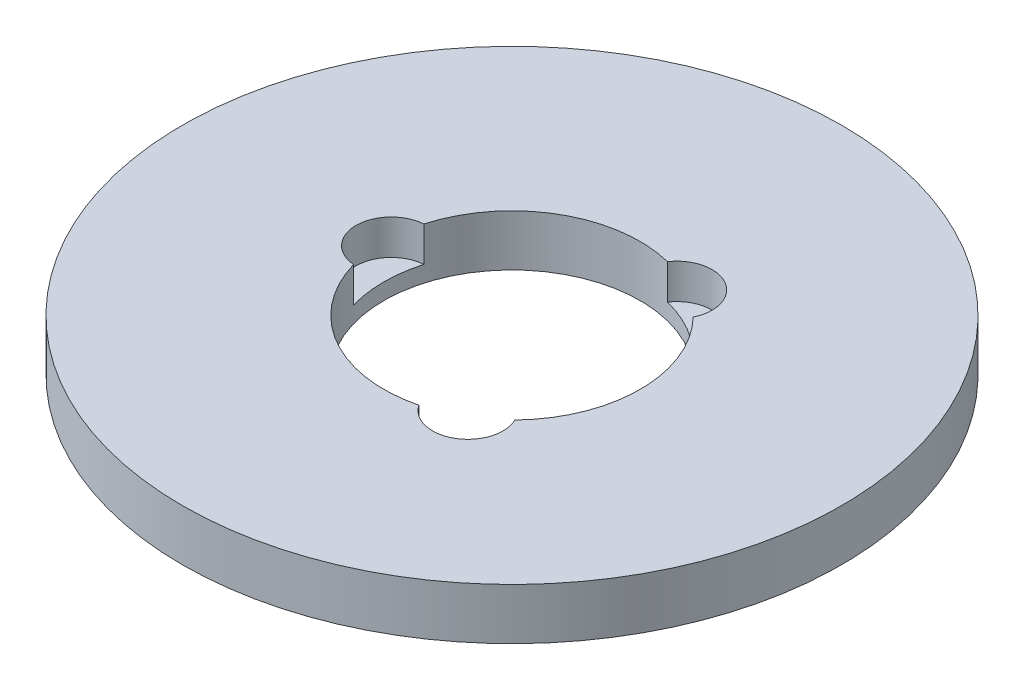
from build123d import *

# Parameters (mm, degrees)
SKETCH1_R           = 90
BOSS_EXTRUDE1_DEPTH = 14
SKETCH2_R           = 35
CUT_EXTRUDE1_DEPTH  = 129.04686642
SKETCH3_R           = 9.621439394
CUT_EXTRUDE2_DEPTH  = 9.567018908
CIRPATTERN1_COUNT   = 3


with BuildPart() as part:
    # Sketch1 → Boss-Extrude1 (new body)
    with BuildSketch(Plane(origin=(0, 0, 0), x_dir=(1, 0, 0), z_dir=(0, 1, 0))):
        Circle(SKETCH1_R)
    extrude(amount=BOSS_EXTRUDE1_DEPTH)

    # Sketch2 → Cut-Extrude1 (cut, through all)
    with BuildSketch(Plane(origin=(0, 0, 0), x_dir=(1, 0, 0), z_dir=(0, 1, 0))):
        Circle(SKETCH2_R)
    extrude(amount=CUT_EXTRUDE1_DEPTH, mode=Mode.SUBTRACT)

    # Sketch3 → Cut-Extrude2 (cut)
    with BuildSketch(Plane(origin=(0, 14, 0), x_dir=(1, 0, 0), z_dir=(0, 1, 0))):
        with Locations((-32.960625028, 0)):
            Circle(SKETCH3_R)
    cut_extrude2 = extrude(amount=-CUT_EXTRUDE2_DEPTH, mode=Mode.SUBTRACT)

    # CirPattern1: Cut-Extrude2 ×3 about axis
    cirpattern1_axis = Axis((0, 0, 0), (0, 1, 0))
    for i in range(1, CIRPATTERN1_COUNT):
        add(cut_extrude2.rotate(cirpattern1_axis, i * 360 / CIRPATTERN1_COUNT), mode=Mode.SUBTRACT)


solid = part.part
